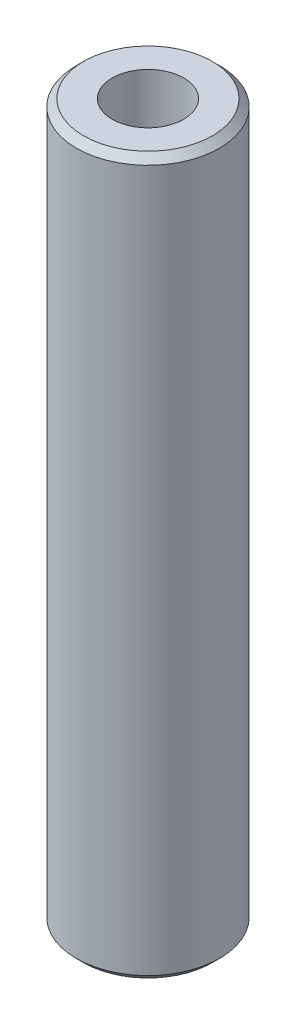
from build123d import *

# Parameters (mm, degrees)
SKETCH1_R           = 10
BOSS_EXTRUDE1_DEPTH = 100
SKETCH2_R           = 5
CUT_EXTRUDE1_DEPTH  = 101.995049384
CHAMFER1_SIZE       = 1


with BuildPart() as part:
    # Sketch1 → Boss-Extrude1 (new body)
    with BuildSketch(Plane(origin=(0, 0, 0), x_dir=(1, 0, 0), z_dir=(0, 1, 0))):
        Circle(SKETCH1_R)
    extrude(amount=BOSS_EXTRUDE1_DEPTH)

    # Sketch2 → Cut-Extrude1 (cut, through all)
    with BuildSketch(Plane(origin=(0, 0, 0), x_dir=(1, 0, 0), z_dir=(0, 1, 0))):
        Circle(SKETCH2_R)
    extrude(amount=CUT_EXTRUDE1_DEPTH, mode=Mode.SUBTRACT)

    # Chamfer1
    chamfer1_edges = [part.edges().sort_by_distance(p)[0] for p in [
        (-10, 100, 0),
        (-10, 0, 0),
    ]]
    chamfer(chamfer1_edges, length=CHAMFER1_SIZE)


solid = part.part
